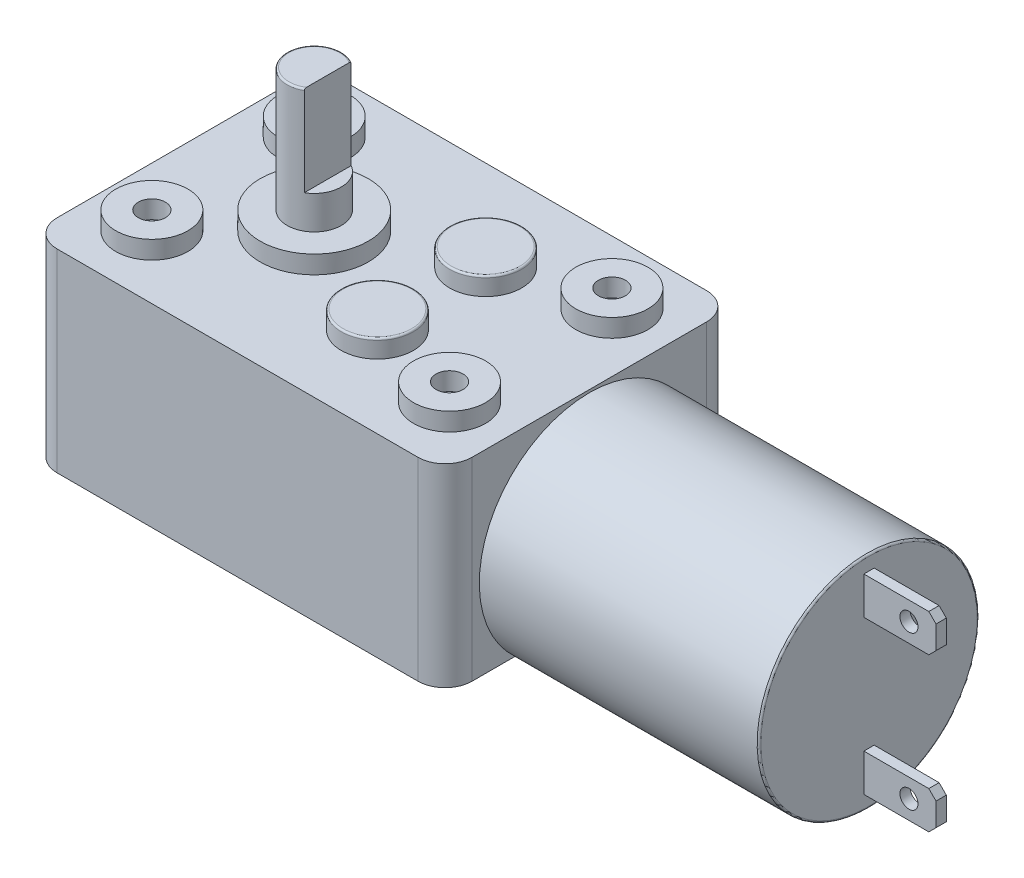
from build123d import *

# Parameters (mm, degrees)
SKETCH1_W           = 46
SKETCH1_H           = 32
BOSS_EXTRUDE1_DEPTH = 21.5
SKETCH2_R           = 4
SKETCH2_R_2         = 1.5
BOSS_EXTRUDE2_DEPTH = 2
FILLET1_R           = 3
FILLET2_R           = 3
SKETCH3_R           = 3
BOSS_EXTRUDE3_DEPTH = 15.7
CUT_EXTRUDE1_START  = -10
CUT_EXTRUDE1_DEPTH  = 10
SKETCH6_R           = 6
BOSS_EXTRUDE4_DEPTH = 2
SKETCH7_R           = 12.2
BOSS_EXTRUDE5_DEPTH = 31
SKETCH8_W           = 1.14055435
SKETCH8_H           = 4.159430758
BOSS_EXTRUDE6_DEPTH = 8
CHAMFER1_SIZE       = 0.8
CHAMFER2_SIZE       = 0.8
SKETCH9_R           = 1
CUT_EXTRUDE2_DEPTH  = 8
SKETCH10_R          = 4
BOSS_EXTRUDE7_DEPTH = 2
FILLET3_R           = 0.2
FILLET4_R           = 0.2
FILLET5_R           = 0.2
FILLET6_R           = 0.2
FILLET7_R           = 0.3
SCALE3_SCALE        = 0.6


with BuildPart() as part:
    # Sketch1 → Boss-Extrude1 (new body)
    with BuildSketch(Plane(origin=(0, 0, 0), x_dir=(1, 0, 0), z_dir=(0, 1, 0))):
        with Locations((23, 16)):
            Rectangle(SKETCH1_W, SKETCH1_H)
    extrude(amount=BOSS_EXTRUDE1_DEPTH)

    # Sketch2 → Boss-Extrude2 (add)
    # profile 1 of 4: a face of its own
    with BuildSketch(Plane(origin=(0, 21.5, 0), x_dir=(1, 0, 0), z_dir=(0, 1, 0))):
        with Locations(Location((6.5, 25, 0), (0, 0, 90))):
            Circle(SKETCH2_R)
        with Locations(Location((6.5, 25, 0), (0, 0, 270))):
            Circle(SKETCH2_R_2, mode=Mode.SUBTRACT)
    # profile 2 of 4: a face of its own
    with BuildSketch(Plane(origin=(0, 21.5, 0), x_dir=(1, 0, 0), z_dir=(0, 1, 0))):
        with Locations(Location((39.5, 25, 0), (0, 0, 90))):
            Circle(SKETCH2_R)
        with Locations(Location((39.5, 25, 0), (0, 0, 270))):
            Circle(SKETCH2_R_2, mode=Mode.SUBTRACT)
    # profile 3 of 4: a face of its own
    with BuildSketch(Plane(origin=(0, 21.5, 0), x_dir=(1, 0, 0), z_dir=(0, 1, 0))):
        with Locations(Location((39.5, 7, 0), (0, 0, 90))):
            Circle(SKETCH2_R)
        with Locations(Location((39.5, 7, 0), (0, 0, 90))):
            Circle(SKETCH2_R_2, mode=Mode.SUBTRACT)
    # profile 4 of 4: a face of its own
    with BuildSketch(Plane(origin=(0, 21.5, 0), x_dir=(1, 0, 0), z_dir=(0, 1, 0))):
        with Locations(Location((6.5, 7, 0), (0, 0, 90))):
            Circle(SKETCH2_R)
        with Locations(Location((6.5, 7, 0), (0, 0, 90))):
            Circle(SKETCH2_R_2, mode=Mode.SUBTRACT)
    extrude(amount=BOSS_EXTRUDE2_DEPTH)

    # Fillet1
    fillet1_edges = [part.edges().sort_by_distance(p)[0] for p in [
        (46, 10.75, -32),
    ]]
    fillet(fillet1_edges, radius=FILLET1_R)

    # Fillet2
    fillet2_edges = [part.edges().sort_by_distance(p)[0] for p in [
        (0, 10.75, -32),
        (46, 10.75, 0),
        (0, 10.75, 0),
    ]]
    fillet(fillet2_edges, radius=FILLET2_R)

    # Sketch3 → Boss-Extrude3 (add)
    with BuildSketch(Plane(origin=(0, 21.5, 0), x_dir=(1, 0, 0), z_dir=(0, 1, 0))):
        with Locations(Location((15.5, 16, 0), (0, 0, 90))):
            Circle(SKETCH3_R)
    extrude(amount=BOSS_EXTRUDE3_DEPTH)

    # Sketch5 → Cut-Extrude1 (cut)
    with BuildSketch(Plane(origin=(0, 37.2, 0), x_dir=(1, 0, 0), z_dir=(0, 1, 0)).offset(CUT_EXTRUDE1_START)):
        with BuildLine():
            Line((17, 18.598076211), (17, 13.401923789))
            ThreePointArc((17, 13.401923789), (18.5, 16), (17, 18.598076211))
        make_face()
    extrude(amount=CUT_EXTRUDE1_DEPTH, mode=Mode.SUBTRACT)

    # Sketch6 → Boss-Extrude4 (add)
    with BuildSketch(Plane(origin=(0, 21.5, 0), x_dir=(1, 0, 0), z_dir=(0, 1, 0))):
        with Locations(Location((15.5, 16, 0), (0, 0, 90))):
            Circle(SKETCH6_R)
    extrude(amount=BOSS_EXTRUDE4_DEPTH)

    # Sketch7 → Boss-Extrude5 (add)
    with BuildSketch(Plane(origin=(46, 0, 0), x_dir=(0, 0, -1), z_dir=(1, 0, 0))):
        with Locations(Location((16, 9, 0), (0, 0, 227.536275048))):
            Circle(SKETCH7_R)
    extrude(amount=BOSS_EXTRUDE5_DEPTH)

    # Sketch8 → Boss-Extrude6 (add)
    with BuildSketch(Plane(origin=(77, 0, 0), x_dir=(0, 0, -1), z_dir=(1, 0, 0))):
        with Locations((16, 17.5)):
            Rectangle(SKETCH8_W, SKETCH8_H)
        with Locations((16, 0.5)):
            Rectangle(SKETCH8_W, SKETCH8_H)
    extrude(amount=BOSS_EXTRUDE6_DEPTH)

    # Chamfer1
    chamfer1_edges = [part.edges().sort_by_distance(p)[0] for p in [
        (85, 19.579715379, -16),
    ]]
    chamfer(chamfer1_edges, length=CHAMFER1_SIZE)

    # Chamfer2
    chamfer2_edges = [part.edges().sort_by_distance(p)[0] for p in [
        (85, -1.579715379, -16),
        (85, 2.579715379, -16),
        (85, 15.420284621, -16),
    ]]
    chamfer(chamfer2_edges, length=CHAMFER2_SIZE)

    # Sketch9 → Cut-Extrude2 (cut)
    with BuildSketch(Plane.XY.offset(-15.429722825)):
        with Locations((82, 17.5)):
            Circle(SKETCH9_R)
        with Locations((82, 0.5)):
            Circle(SKETCH9_R)
    extrude(amount=-CUT_EXTRUDE2_DEPTH, mode=Mode.SUBTRACT)

    # Sketch10 → Boss-Extrude7 (add)
    with BuildSketch(Plane(origin=(0, 21.5, 0), x_dir=(1, 0, 0), z_dir=(0, 1, 0))):
        with Locations(Location((28.5, 22, 0), (0, 0, 90))):
            Circle(SKETCH10_R)
        with Locations(Location((28.5, 10, 0), (0, 0, 90))):
            Circle(SKETCH10_R)
    extrude(amount=BOSS_EXTRUDE7_DEPTH)

    # Fillet3
    fillet3_edges = [part.edges().sort_by_distance(p)[0] for p in [
        (28.5, 23.5, -6),
    ]]
    fillet(fillet3_edges, radius=FILLET3_R)

    # Fillet4
    fillet4_edges = [part.edges().sort_by_distance(p)[0] for p in [
        (28.5, 23.5, -18),
    ]]
    fillet(fillet4_edges, radius=FILLET4_R)

    # Fillet5
    fillet5_edges = [part.edges().sort_by_distance(p)[0] for p in [
        (12.602222521, 37.2, -15.223542865),
    ]]
    fillet(fillet5_edges, radius=FILLET5_R)

    # Fillet6
    fillet6_edges = [part.edges().sort_by_distance(p)[0] for p in [
        (77, 18, -24.236504113),
    ]]
    fillet(fillet6_edges, radius=FILLET6_R)

    # Fillet7
    # the kernel refuses this fillet: 0.3 mm, written as the material it takes off along each edge
    with BuildSketch(Plane(origin=(46, 9, -16), x_dir=(0, -0.6948182221031018, 0.7191853990686162), z_dir=(0, 0.7191853990686162, 0.6948182221031018))) as fillet7_piece_1_section:
        with BuildLine():
            CenterArc((12.2 - FILLET7_R, FILLET7_R), FILLET7_R, 270, 90)
            Line((12.2 - FILLET7_R, 0), (12.2, 0))
            Line((12.2, 0), (12.2, FILLET7_R))
        make_face()
    fillet7_piece_1 = revolve(axis=Axis((46, 9, -16), (1, 0, 0)), revolution_arc=91.974532738, mode=Mode.PRIVATE)
    fillet7_piece_1 = split(fillet7_piece_1, bisect_by=Plane(origin=(46.082910909, 0, -16), z_dir=(0, -1, 0)), keep=Keep.TOP, mode=Mode.PRIVATE)
    add(fillet7_piece_1, mode=Mode.SUBTRACT)


with BuildPart() as part_1:
    # Scale3: scaled about (34.850364497, 10.537899591, -15.999999996)
    add(part.part.scale(SCALE3_SCALE).moved(Location((13.940145799, 4.215159836, -6.399999998))))


solid = part_1.part
